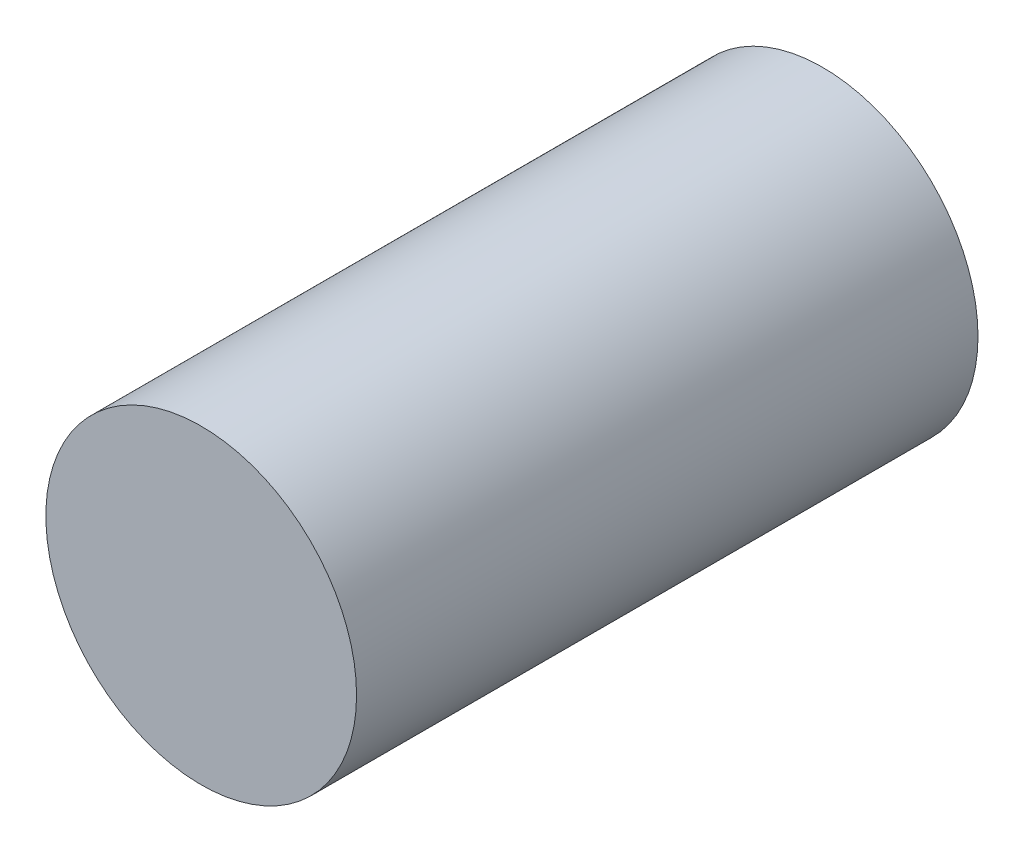
from build123d import *

# Parameters (mm, degrees)
SKETCH1_R           = 12.5
BOSS_EXTRUDE1_DEPTH = 50


with BuildPart() as part:
    # Sketch1 → Boss-Extrude1 (new body)
    with BuildSketch(Plane.XY):
        Circle(SKETCH1_R)
    extrude(amount=BOSS_EXTRUDE1_DEPTH)


solid = part.part
